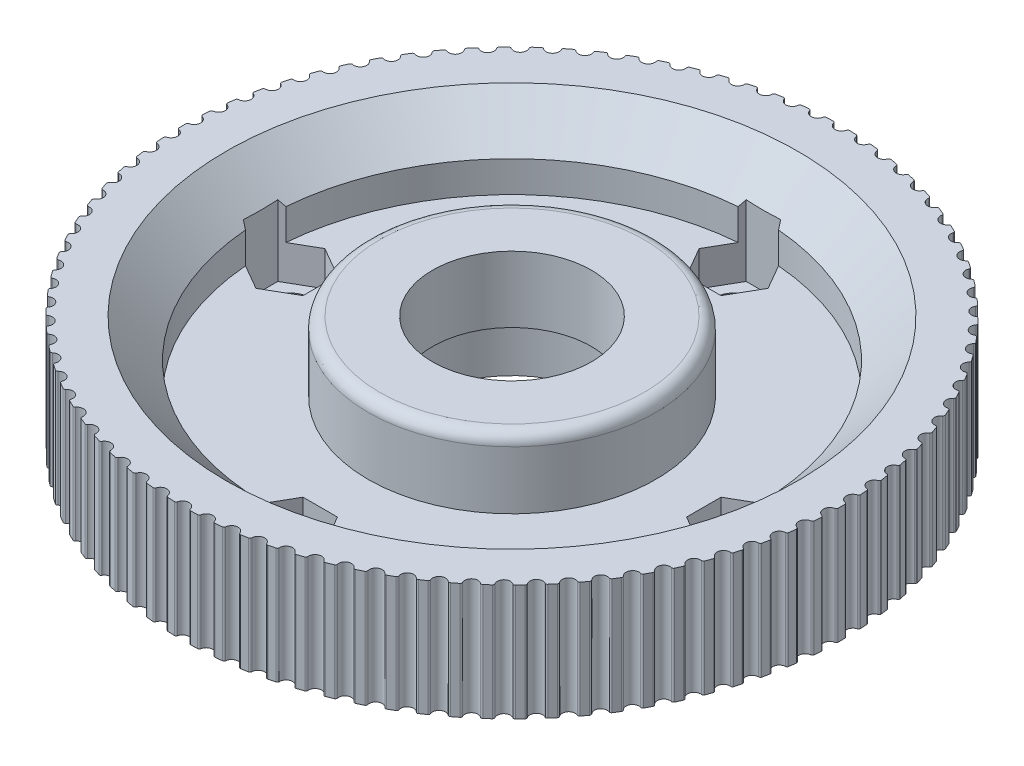
from build123d import *

# Parameters (mm, degrees)
SKETCH1_R           = 6.85
SKETCH1_R_2         = 1.65
BOSS_EXTRUDE1_DEPTH = 10
CIRPATTERN1_START   = -1
CIRPATTERN1_DEPTH   = 12
SKETCH1_3_R         = 7.85
CUT_EXTRUDE1_DEPTH  = 4.3
CUT_EXTRUDE2_DEPTH  = 9
SKETCH2_3_R         = 12.4
CUT_EXTRUDE3_DEPTH  = 6
CHAMFER1_SIZE       = 3.32
FILLET1_R           = 1
CUT_EXTRUDE4_DEPTH  = 9


with BuildPart() as part:
    # Sketch1 → Boss-Extrude1 (new body)
    with BuildSketch(Plane(origin=(0, 0, 0), x_dir=(1, 0, 0), z_dir=(0, 1, 0))):
        with BuildLine():
            ThreePointArc((-0.695761821, 28.391476106), (0, -28.4), (0.695761821, 28.391476106))
            ThreePointArc((0.695761821, 28.391476106), (0.60004905, 28.359965255), (0.545871454, 28.275002579))
            ThreePointArc((0.545871454, 28.275002579), (0, 27.84), (-0.545871454, 28.275002579))
            ThreePointArc((-0.545871454, 28.275002579), (-0.60004905, 28.359965255), (-0.695761821, 28.391476106))
        make_face()
        with Locations(Location((0, 0, 0), (0, 0, 270))):
            Circle(SKETCH1_R, mode=Mode.SUBTRACT)
        with Locations(Location((0, 19.1, 0), (0, 0, 270))):
            Circle(SKETCH1_R_2, mode=Mode.SUBTRACT)
        with Locations(Location((19.1, 0, 0), (0, 0, 270))):
            Circle(SKETCH1_R_2, mode=Mode.SUBTRACT)
        with Locations(Location((0, -19.1, 0), (0, 0, 270))):
            Circle(SKETCH1_R_2, mode=Mode.SUBTRACT)
        with Locations(Location((-19.1, 0, 0), (0, 0, 270))):
            Circle(SKETCH1_R_2, mode=Mode.SUBTRACT)
    extrude(amount=BOSS_EXTRUDE1_DEPTH)

    # CirPattern1: read off the stored shape, not the designer's step
    # CirPattern1 outline → CirPattern1 (cut)
    with BuildSketch(Plane(origin=(0, 0, 0), x_dir=(1, 0, 0), z_dir=(0, 1, 0)).offset(CIRPATTERN1_START)):
        with BuildLine():
            ThreePointArc((-2.516906214, 28.168048026), (-1.942020229, 27.772183159), (-1.427822736, 28.244204161))
            ThreePointArc((-1.427822736, 28.244204161), (-1.379703811, 28.332739111), (-1.286422278, 28.370849789))
            ThreePointArc((-1.286422278, 28.370849789), (-1.981083855, 28.330819027), (-2.674556238, 28.273782006))
            ThreePointArc((-2.674556238, 28.273782006), (-2.576878532, 28.2490245), (-2.516906214, 28.168048026))
        make_face()
        with BuildLine():
            ThreePointArc((2.516906214, 28.168048026), (2.576878532, 28.2490245), (2.674556238, 28.273782006))
            ThreePointArc((2.674556238, 28.273782006), (1.981083855, 28.330819027), (1.286422278, 28.370849788))
            ThreePointArc((1.286422278, 28.370849788), (1.379703811, 28.332739111), (1.427822736, 28.244204161))
            ThreePointArc((1.427822736, 28.244204161), (1.942020229, 27.772183159), (2.516906214, 28.168048026))
        make_face()
        with BuildLine():
            ThreePointArc((4.475678859, 27.923861574), (4.541153721, 28.000457336), (4.640320485, 28.018340882))
            ThreePointArc((4.640320485, 28.018340882), (3.952516067, 28.123613152), (3.262339056, 28.212003542))
            ThreePointArc((3.262339056, 28.212003542), (3.352734894, 28.16747871), (3.394560718, 28.07580282))
            ThreePointArc((3.394560718, 28.07580282), (3.874579131, 27.569063034), (4.475678859, 27.923861574))
        make_face()
        with BuildLine():
            ThreePointArc((6.412646447, 27.543632876), (6.483304866, 27.615474759), (6.583477558, 27.626397218))
            ThreePointArc((6.583477558, 27.626397218), (5.904692019, 27.779391861), (5.222362046, 27.915711251))
            ThreePointArc((5.222362046, 27.915711251), (5.309431789, 27.864989184), (5.344760741, 27.77061899))
            ThreePointArc((5.344760741, 27.77061899), (5.788261472, 27.231629204), (6.412646447, 27.543632876))
        make_face()
        with BuildLine():
            ThreePointArc((8.318372267, 27.029214367), (8.393870001, 27.095952365), (8.49456059, 27.099860523))
            ThreePointArc((8.49456059, 27.099860523), (7.828100905, 27.299832164), (7.156942214, 27.48341642))
            ThreePointArc((7.156942214, 27.48341642), (7.240261667, 27.426744232), (7.268921627, 27.330139496))
            ThreePointArc((7.268921627, 27.330139496), (7.673743986, 26.761525615), (8.318372267, 27.029214367))
        make_face()
        with BuildLine():
            ThreePointArc((10.183571812, 26.383112243), (10.263541046, 26.444421214), (10.364258976, 26.441296033))
            ThreePointArc((10.364258976, 26.441296033), (9.71337207, 26.68727043), (9.056654478, 26.917225148))
            ThreePointArc((9.056654478, 26.917225148), (9.135817717, 26.854878938), (9.157669057, 26.756510309))
            ThreePointArc((9.157669057, 26.756510309), (9.52184079, 26.161042563), (10.183571812, 26.383112243))
        make_face()
        with BuildLine():
            ThreePointArc((11.999158019, 25.608474248), (12.083209149, 25.664055502), (12.183463734, 25.653912205))
            ThreePointArc((12.183463734, 25.653912205), (11.551320663, 25.944690997), (10.912243632, 26.21989586))
            ThreePointArc((10.912243632, 26.21989586), (10.986864982, 26.152179374), (11.001801244, 26.052526094))
            ThreePointArc((11.001801244, 26.052526094), (11.323548143, 25.433105541), (11.999158019, 25.608474248))
        make_face()
        with BuildLine():
            ThreePointArc((13.756285535, 24.70907434), (13.844009073, 24.758657091), (13.943311882, 24.741545096))
            ThreePointArc((13.943311882, 24.741545096), (13.332992383, 25.075711637), (12.714669432, 25.394825875))
            ThreePointArc((12.714669432, 25.394825875), (12.784385345, 25.322069021), (12.792333762, 25.22161659))
            ThreePointArc((12.792333762, 25.22161659), (13.070088308, 24.581260985), (13.756285535, 24.70907434))
        make_face()
        with BuildLine():
            ThreePointArc((15.44639381, 23.689294306), (15.537362376, 23.732636991), (15.635229616, 23.708639667))
            ThreePointArc((15.635229616, 23.708639667), (15.049707104, 24.084565931), (14.455150641, 24.446034851))
            ThreePointArc((14.455150641, 24.446034851), (14.519621467, 24.368592093), (14.520543315, 24.267829905))
            ThreePointArc((14.520543315, 24.267829905), (14.752952316, 23.609658997), (15.44639381, 23.689294306))
        make_face()
        with BuildLine():
            ThreePointArc((17.061248808, 22.554102412), (17.155019212, 22.590993869), (17.250974083, 22.560228128))
            ThreePointArc((17.250974083, 22.560228128), (16.693101165, 22.97608264), (16.125207809, 23.378145203))
            ThreePointArc((16.125207809, 23.378145203), (16.184119454, 23.296393834), (16.178010241, 23.195812793))
            ThreePointArc((16.178010241, 23.195812793), (16.363941424, 22.523033123), (17.061248808, 22.554102412))
        make_face()
        with BuildLine():
            ThreePointArc((18.592983116, 21.309029197), (18.689098517, 21.339289696), (18.782673538, 21.301905425))
            ThreePointArc((18.782673538, 21.301905425), (18.255168115, 21.755662185), (17.716704585, 22.196359581))
            ThreePointArc((17.716704585, 22.196359581), (17.769770037, 22.110697885), (17.756659527, 22.010788012))
            ThreePointArc((17.756659527, 22.010788012), (17.895207054, 21.326677296), (18.592983116, 21.309029197))
        make_face()
        with BuildLine():
            ThreePointArc((20.034134279, 19.960140535), (20.132126414, 19.983622649), (20.222865696, 19.939801981))
            ThreePointArc((20.222865696, 19.939801981), (19.728297721, 20.429250329), (19.221887358, 20.906435526))
            ThreePointArc((19.221887358, 20.906435526), (19.268848087, 20.81728084), (19.248800153, 20.718528885))
            ThreePointArc((19.248800153, 20.718528885), (19.339289033, 20.026420042), (20.034134279, 19.960140535))
        make_face()
        with BuildLine():
            ThreePointArc((21.377681154, 18.514008074), (21.477072615, 18.530597401), (21.564534085, 18.480553825))
            ThreePointArc((21.564534085, 18.480553825), (21.105313044, 19.00330922), (20.633423027, 19.514657419))
            ThreePointArc((20.633423027, 19.514657419), (20.674050246, 19.422444094), (20.64716256, 19.325331167))
            ThreePointArc((20.64716256, 19.325331167), (20.689151941, 18.628596081), (21.377681154, 18.514008074))
        make_face()
        with BuildLine():
            ThreePointArc((22.617078115, 16.977677226), (22.717384676, 16.987292945), (22.801142232, 16.931270269))
            ThreePointArc((22.801142232, 16.931270269), (22.379505402, 17.484785899), (21.944434733, 18.027805863))
            ThreePointArc((21.944434733, 18.027805863), (21.97853051, 17.932983153), (21.944934065, 17.837982379))
            ThreePointArc((21.944934065, 17.837982379), (21.93821938, 17.140015473), (22.617078115, 16.977677226))
        make_face()
        with BuildLine():
            ThreePointArc((23.746286945, 15.358632842), (23.847019923, 15.361228106), (23.926665505, 15.299499267))
            ThreePointArc((23.926665505, 15.299499267), (23.54466706, 15.881078459), (23.148535359, 16.453124649))
            ThreePointArc((23.148535359, 16.453124649), (23.175933583, 16.356154521), (23.135792058, 16.263728733))
            ThreePointArc((23.135792058, 16.263728733), (23.08040602, 15.567930433), (23.746286945, 15.358632842))
        make_face()
        with BuildLine():
            ThreePointArc((24.759806253, 13.664762743), (24.860474887, 13.660324907), (24.935620469, 13.593190641))
            ThreePointArc((24.935620469, 13.593190641), (24.595121467, 14.2), (24.239858648, 14.798285465))
            ThreePointArc((24.239858648, 14.798285465), (24.260425837, 14.699640348), (24.213934798, 14.610239836))
            ThreePointArc((24.213934798, 14.610239836), (24.110147241, 13.92), (24.759806253, 13.664762743))
        make_face()
        with BuildLine():
            ThreePointArc((25.652698272, 11.904319293), (25.752812115, 11.892869978), (25.823091597, 11.820657357))
            ThreePointArc((25.823091597, 11.820657357), (25.525750915, 12.449740569), (25.213087783, 13.071350522))
            ThreePointArc((25.213087783, 13.071350522), (25.226723735, 12.971511005), (25.174109682, 12.885571319))
            ThreePointArc((25.174109682, 12.885571319), (25.022426249, 12.204252727), (25.652698272, 11.904319293))
        make_face()
        with BuildLine():
            ThreePointArc((26.420612925, 10.085879196), (26.519684232, 10.067474183), (26.584755219, 9.990535019))
            ThreePointArc((26.584755219, 9.990535019), (26.33202147, 10.638827253), (26.063481287, 11.280733273))
            ThreePointArc((26.063481287, 11.280733273), (26.07011957, 11.180185765), (26.011638833, 11.098125594))
            ThreePointArc((26.011638833, 11.098125594), (25.812798511, 10.429047561), (26.420612925, 10.085879196))
        make_face()
        with BuildLine():
            ThreePointArc((27.059809007, 8.218301709), (27.157355112, 8.193030665), (27.216900585, 8.111739799))
            ThreePointArc((27.216900585, 8.111739799), (27.010005063, 8.77608264), (26.786896131, 9.435157426))
            ThreePointArc((26.786896131, 9.435157426), (26.786504404, 9.334391783), (26.722441895, 9.256610917))
            ThreePointArc((26.722441895, 9.256610917), (26.477413414, 8.603033124), (27.059809007, 8.218301709))
        make_face()
        with BuildLine():
            ThreePointArc((27.56717242, 6.310685483), (27.662718088, 6.278671525), (27.716447947, 6.193424997))
            ThreePointArc((27.716447947, 6.193424997), (27.556398626, 6.870581835), (27.37980791, 7.54361444))
            ThreePointArc((27.37980791, 7.54361444), (27.372388081, 7.443121582), (27.303055906, 7.369998961))
            ThreePointArc((27.303055906, 7.369998961), (27.01303302, 6.735105573), (27.56717242, 6.310685483))
        make_face()
        with BuildLine():
            ThreePointArc((27.940231339, 4.372324231), (28.033311083, 4.333723329), (28.080963561, 4.244936452))
            ThreePointArc((28.080963561, 4.244936452), (27.968540185, 4.931608246), (27.839328016, 5.615319723))
            ThreePointArc((27.839328016, 5.615319723), (27.824916235, 5.515589242), (27.750652173, 5.447481112))
            ThreePointArc((27.750652173, 5.447481112), (27.417047844, 4.834365267), (27.940231339, 4.372324231))
        make_face()
        with BuildLine():
            ThreePointArc((28.177168261, 2.412661455), (28.267328603, 2.367661668), (28.308671543, 2.275767002))
            ThreePointArc((28.308671543, 2.275767002), (28.244421828, 2.968608356), (28.163217715, 3.659667732))
            ThreePointArc((28.163217715, 3.659667732), (28.141884193, 3.561185505), (28.063050052, 3.498423682))
            ThreePointArc((28.063050052, 3.498423682), (27.687489567, 2.910072417), (28.177168261, 2.412661455))
        make_face()
        with BuildLine():
            ThreePointArc((28.27682885, 0.441244435), (28.363630541, 0.390064998), (28.398462523, 0.295510245))
            ThreePointArc((28.398462523, 0.295510245), (28.382699487, 0.991145706), (28.349899049, 1.686186208))
            ThreePointArc((28.349899049, 1.686186208), (28.321747721, 1.58943203), (28.238727572, 1.532322284))
            ThreePointArc((28.238727572, 1.532322284), (27.823040624, 0.971601988), (28.27682885, 0.441244435))
        make_face()
        with BuildLine():
            ThreePointArc((28.238727572, -1.532322284), (28.321747721, -1.58943203), (28.349899049, -1.686186208))
            ThreePointArc((28.349899049, -1.686186208), (28.382699487, -0.991145706), (28.398462523, -0.295510245))
            ThreePointArc((28.398462523, -0.295510245), (28.363630541, -0.390064998), (28.27682885, -0.441244435))
            ThreePointArc((28.27682885, -0.441244435), (27.823040624, -0.971601988), (28.238727572, -1.532322284))
        make_face()
        with BuildLine():
            ThreePointArc((28.063050052, -3.498423682), (28.141884193, -3.561185505), (28.163217716, -3.659667732))
            ThreePointArc((28.163217716, -3.659667732), (28.244421828, -2.968608356), (28.308671543, -2.275767002))
            ThreePointArc((28.308671543, -2.275767002), (28.267328603, -2.367661668), (28.177168261, -2.412661455))
            ThreePointArc((28.177168261, -2.412661455), (27.687489567, -2.910072417), (28.063050052, -3.498423682))
        make_face()
        with BuildLine():
            ThreePointArc((27.750652173, -5.447481112), (27.824916235, -5.515589242), (27.839328017, -5.615319723))
            ThreePointArc((27.839328017, -5.615319723), (27.968540185, -4.931608246), (28.080963561, -4.244936452))
            ThreePointArc((28.080963561, -4.244936452), (28.033311083, -4.333723329), (27.940231339, -4.372324231))
            ThreePointArc((27.940231339, -4.372324231), (27.417047844, -4.834365267), (27.750652173, -5.447481112))
        make_face()
        with BuildLine():
            ThreePointArc((27.303055906, -7.369998961), (27.372388081, -7.443121582), (27.37980791, -7.54361444))
            ThreePointArc((27.37980791, -7.54361444), (27.556398626, -6.870581835), (27.716447947, -6.193424997))
            ThreePointArc((27.716447947, -6.193424997), (27.662718088, -6.278671525), (27.56717242, -6.310685483))
            ThreePointArc((27.56717242, -6.310685483), (27.01303302, -6.735105573), (27.303055906, -7.369998961))
        make_face()
        with BuildLine():
            ThreePointArc((26.722441895, -9.256610917), (26.786504404, -9.334391783), (26.786896131, -9.435157426))
            ThreePointArc((26.786896131, -9.435157426), (27.010005063, -8.776082641), (27.216900585, -8.111739799))
            ThreePointArc((27.216900585, -8.111739799), (27.157355112, -8.193030665), (27.059809007, -8.218301709))
            ThreePointArc((27.059809007, -8.218301709), (26.477413414, -8.603033124), (26.722441895, -9.256610917))
        make_face()
        with BuildLine():
            ThreePointArc((26.011638833, -11.098125594), (26.07011957, -11.180185765), (26.063481287, -11.280733273))
            ThreePointArc((26.063481287, -11.280733273), (26.33202147, -10.638827253), (26.584755219, -9.990535019))
            ThreePointArc((26.584755219, -9.990535019), (26.519684232, -10.067474183), (26.420612925, -10.085879196))
            ThreePointArc((26.420612925, -10.085879196), (25.812798511, -10.429047561), (26.011638833, -11.098125594))
        make_face()
        with BuildLine():
            ThreePointArc((25.174109682, -12.885571319), (25.226723735, -12.971511005), (25.213087783, -13.071350522))
            ThreePointArc((25.213087783, -13.071350522), (25.525750915, -12.449740569), (25.823091597, -11.820657357))
            ThreePointArc((25.823091597, -11.820657357), (25.752812115, -11.892869978), (25.652698272, -11.904319293))
            ThreePointArc((25.652698272, -11.904319293), (25.022426249, -12.204252727), (25.174109682, -12.885571319))
        make_face()
        with BuildLine():
            ThreePointArc((24.213934798, -14.610239836), (24.260425837, -14.699640348), (24.239858648, -14.798285465))
            ThreePointArc((24.239858648, -14.798285465), (24.595121467, -14.2), (24.935620469, -13.593190641))
            ThreePointArc((24.935620469, -13.593190641), (24.860474887, -13.660324907), (24.759806253, -13.664762743))
            ThreePointArc((24.759806253, -13.664762743), (24.110147241, -13.92), (24.213934798, -14.610239836))
        make_face()
        with BuildLine():
            ThreePointArc((23.135792058, -16.263728733), (23.175933583, -16.356154521), (23.14853536, -16.453124649))
            ThreePointArc((23.14853536, -16.453124649), (23.54466706, -15.881078459), (23.926665505, -15.299499267))
            ThreePointArc((23.926665505, -15.299499267), (23.847019923, -15.361228106), (23.746286945, -15.358632842))
            ThreePointArc((23.746286945, -15.358632842), (23.08040602, -15.567930433), (23.135792058, -16.263728733))
        make_face()
        with BuildLine():
            ThreePointArc((21.944934065, -17.837982379), (21.97853051, -17.932983153), (21.944434733, -18.027805863))
            ThreePointArc((21.944434733, -18.027805863), (22.379505403, -17.484785899), (22.801142232, -16.931270269))
            ThreePointArc((22.801142232, -16.931270269), (22.717384676, -16.987292945), (22.617078115, -16.977677226))
            ThreePointArc((22.617078115, -16.977677226), (21.93821938, -17.140015473), (21.944934065, -17.837982379))
        make_face()
        with BuildLine():
            ThreePointArc((20.64716256, -19.325331167), (20.674050246, -19.422444094), (20.633423027, -19.514657419))
            ThreePointArc((20.633423027, -19.514657419), (21.105313044, -19.00330922), (21.564534085, -18.480553825))
            ThreePointArc((21.564534085, -18.480553825), (21.477072615, -18.530597401), (21.377681154, -18.514008074))
            ThreePointArc((21.377681154, -18.514008074), (20.689151941, -18.628596081), (20.64716256, -19.325331167))
        make_face()
        with BuildLine():
            ThreePointArc((19.248800153, -20.718528885), (19.268848087, -20.81728084), (19.221887358, -20.906435526))
            ThreePointArc((19.221887358, -20.906435526), (19.728297721, -20.42925033), (20.222865696, -19.939801981))
            ThreePointArc((20.222865696, -19.939801981), (20.132126414, -19.983622649), (20.034134279, -19.960140535))
            ThreePointArc((20.034134279, -19.960140535), (19.339289033, -20.026420042), (19.248800153, -20.718528885))
        make_face()
        with BuildLine():
            ThreePointArc((17.756659527, -22.010788012), (17.769770037, -22.110697885), (17.716704585, -22.196359581))
            ThreePointArc((17.716704585, -22.196359581), (18.255168115, -21.755662185), (18.782673538, -21.301905425))
            ThreePointArc((18.782673538, -21.301905425), (18.689098517, -21.339289696), (18.592983116, -21.309029197))
            ThreePointArc((18.592983116, -21.309029197), (17.895207054, -21.326677296), (17.756659527, -22.010788012))
        make_face()
        with BuildLine():
            ThreePointArc((16.178010241, -23.195812793), (16.184119454, -23.296393834), (16.125207809, -23.378145203))
            ThreePointArc((16.125207809, -23.378145203), (16.693101165, -22.97608264), (17.250974083, -22.560228128))
            ThreePointArc((17.250974083, -22.560228128), (17.155019212, -22.590993869), (17.061248808, -22.554102412))
            ThreePointArc((17.061248808, -22.554102412), (16.363941424, -22.523033123), (16.178010241, -23.195812793))
        make_face()
        with BuildLine():
            ThreePointArc((14.520543315, -24.267829905), (14.519621467, -24.368592093), (14.455150641, -24.446034851))
            ThreePointArc((14.455150641, -24.446034851), (15.049707104, -24.084565931), (15.635229616, -23.708639667))
            ThreePointArc((15.635229616, -23.708639667), (15.537362376, -23.732636991), (15.44639381, -23.689294306))
            ThreePointArc((15.44639381, -23.689294306), (14.752952316, -23.609658997), (14.520543315, -24.267829905))
        make_face()
        with BuildLine():
            ThreePointArc((12.792333762, -25.22161659), (12.784385345, -25.322069021), (12.714669432, -25.394825875))
            ThreePointArc((12.714669432, -25.394825875), (13.332992383, -25.075711637), (13.943311882, -24.741545096))
            ThreePointArc((13.943311882, -24.741545096), (13.844009073, -24.758657091), (13.756285535, -24.70907434))
            ThreePointArc((13.756285535, -24.70907434), (13.070088308, -24.581260985), (12.792333762, -25.22161659))
        make_face()
        with BuildLine():
            ThreePointArc((11.001801244, -26.052526094), (10.986864982, -26.152179374), (10.912243632, -26.21989586))
            ThreePointArc((10.912243632, -26.21989586), (11.551320663, -25.944690997), (12.183463734, -25.653912205))
            ThreePointArc((12.183463734, -25.653912205), (12.083209149, -25.664055502), (11.999158019, -25.608474248))
            ThreePointArc((11.999158019, -25.608474248), (11.323548143, -25.433105541), (11.001801244, -26.052526094))
        make_face()
        with BuildLine():
            ThreePointArc((9.157669057, -26.756510309), (9.135817717, -26.854878938), (9.056654478, -26.917225148))
            ThreePointArc((9.056654478, -26.917225148), (9.71337207, -26.68727043), (10.364258976, -26.441296033))
            ThreePointArc((10.364258976, -26.441296033), (10.263541046, -26.444421214), (10.183571812, -26.383112243))
            ThreePointArc((10.183571812, -26.383112243), (9.52184079, -26.161042563), (9.157669057, -26.756510309))
        make_face()
        with BuildLine():
            ThreePointArc((7.268921627, -27.330139496), (7.240261667, -27.426744232), (7.156942214, -27.483416421))
            ThreePointArc((7.156942214, -27.483416421), (7.828100906, -27.299832165), (8.49456059, -27.099860523))
            ThreePointArc((8.49456059, -27.099860523), (8.393870001, -27.095952365), (8.318372267, -27.029214367))
            ThreePointArc((8.318372267, -27.029214367), (7.673743986, -26.761525615), (7.268921627, -27.330139496))
        make_face()
        with BuildLine():
            ThreePointArc((5.344760741, -27.77061899), (5.309431789, -27.864989184), (5.222362046, -27.915711251))
            ThreePointArc((5.222362046, -27.915711251), (5.904692019, -27.779391861), (6.583477558, -27.626397218))
            ThreePointArc((6.583477558, -27.626397218), (6.483304866, -27.615474759), (6.412646447, -27.543632876))
            ThreePointArc((6.412646447, -27.543632876), (5.788261472, -27.231629204), (5.344760741, -27.77061899))
        make_face()
        with BuildLine():
            ThreePointArc((3.394560718, -28.07580282), (3.352734894, -28.16747871), (3.262339056, -28.212003543))
            ThreePointArc((3.262339056, -28.212003543), (3.952516067, -28.123613152), (4.640320485, -28.018340882))
            ThreePointArc((4.640320485, -28.018340882), (4.541153721, -28.000457336), (4.475678859, -27.923861574))
            ThreePointArc((4.475678859, -27.923861574), (3.874579131, -27.569063034), (3.394560718, -28.07580282))
        make_face()
        with BuildLine():
            ThreePointArc((1.427822736, -28.244204161), (1.379703811, -28.332739111), (1.286422278, -28.370849789))
            ThreePointArc((1.286422278, -28.370849789), (1.981083855, -28.330819027), (2.674556238, -28.273782006))
            ThreePointArc((2.674556238, -28.273782006), (2.576878532, -28.2490245), (2.516906214, -28.168048026))
            ThreePointArc((2.516906214, -28.168048026), (1.942020229, -27.772183159), (1.427822736, -28.244204161))
        make_face()
        with BuildLine():
            ThreePointArc((-0.545871454, -28.275002579), (-0.60004905, -28.359965255), (-0.695761821, -28.391476106))
            ThreePointArc((-0.695761821, -28.391476106), (0, -28.4), (0.695761821, -28.391476106))
            ThreePointArc((0.695761821, -28.391476106), (0.60004905, -28.359965255), (0.545871454, -28.275002579))
            ThreePointArc((0.545871454, -28.275002579), (0, -27.84), (-0.545871454, -28.275002579))
        make_face()
        with BuildLine():
            ThreePointArc((-2.516906214, -28.168048026), (-2.576878532, -28.2490245), (-2.674556238, -28.273782006))
            ThreePointArc((-2.674556238, -28.273782006), (-1.981083855, -28.330819027), (-1.286422278, -28.370849789))
            ThreePointArc((-1.286422278, -28.370849789), (-1.379703811, -28.332739111), (-1.427822736, -28.244204161))
            ThreePointArc((-1.427822736, -28.244204161), (-1.942020229, -27.772183159), (-2.516906214, -28.168048026))
        make_face()
        with BuildLine():
            ThreePointArc((-4.475678859, -27.923861574), (-4.541153721, -28.000457336), (-4.640320485, -28.018340882))
            ThreePointArc((-4.640320485, -28.018340882), (-3.952516067, -28.123613152), (-3.262339056, -28.212003543))
            ThreePointArc((-3.262339056, -28.212003543), (-3.352734894, -28.16747871), (-3.394560718, -28.07580282))
            ThreePointArc((-3.394560718, -28.07580282), (-3.874579131, -27.569063034), (-4.475678859, -27.923861574))
        make_face()
        with BuildLine():
            ThreePointArc((-6.412646447, -27.543632876), (-6.483304866, -27.615474759), (-6.583477558, -27.626397218))
            ThreePointArc((-6.583477558, -27.626397218), (-5.904692019, -27.779391861), (-5.222362046, -27.915711251))
            ThreePointArc((-5.222362046, -27.915711251), (-5.309431789, -27.864989184), (-5.344760741, -27.77061899))
            ThreePointArc((-5.344760741, -27.77061899), (-5.788261472, -27.231629204), (-6.412646447, -27.543632876))
        make_face()
        with BuildLine():
            ThreePointArc((-8.318372267, -27.029214367), (-8.393870001, -27.095952365), (-8.49456059, -27.099860523))
            ThreePointArc((-8.49456059, -27.099860523), (-7.828100906, -27.299832165), (-7.156942214, -27.483416421))
            ThreePointArc((-7.156942214, -27.483416421), (-7.240261667, -27.426744232), (-7.268921627, -27.330139496))
            ThreePointArc((-7.268921627, -27.330139496), (-7.673743986, -26.761525615), (-8.318372267, -27.029214367))
        make_face()
        with BuildLine():
            ThreePointArc((-10.183571812, -26.383112243), (-10.263541046, -26.444421214), (-10.364258976, -26.441296033))
            ThreePointArc((-10.364258976, -26.441296033), (-9.71337207, -26.68727043), (-9.056654478, -26.917225148))
            ThreePointArc((-9.056654478, -26.917225148), (-9.135817717, -26.854878938), (-9.157669057, -26.756510309))
            ThreePointArc((-9.157669057, -26.756510309), (-9.52184079, -26.161042563), (-10.183571812, -26.383112243))
        make_face()
        with BuildLine():
            ThreePointArc((-11.999158019, -25.608474248), (-12.083209149, -25.664055502), (-12.183463734, -25.653912205))
            ThreePointArc((-12.183463734, -25.653912205), (-11.551320663, -25.944690997), (-10.912243632, -26.21989586))
            ThreePointArc((-10.912243632, -26.21989586), (-10.986864982, -26.152179374), (-11.001801244, -26.052526094))
            ThreePointArc((-11.001801244, -26.052526094), (-11.323548143, -25.433105541), (-11.999158019, -25.608474248))
        make_face()
        with BuildLine():
            ThreePointArc((-13.756285535, -24.70907434), (-13.844009073, -24.758657091), (-13.943311882, -24.741545096))
            ThreePointArc((-13.943311882, -24.741545096), (-13.332992383, -25.075711637), (-12.714669432, -25.394825875))
            ThreePointArc((-12.714669432, -25.394825875), (-12.784385345, -25.322069021), (-12.792333762, -25.22161659))
            ThreePointArc((-12.792333762, -25.22161659), (-13.070088308, -24.581260985), (-13.756285535, -24.70907434))
        make_face()
        with BuildLine():
            ThreePointArc((-15.44639381, -23.689294306), (-15.537362376, -23.732636991), (-15.635229616, -23.708639667))
            ThreePointArc((-15.635229616, -23.708639667), (-15.049707104, -24.084565931), (-14.455150641, -24.446034851))
            ThreePointArc((-14.455150641, -24.446034851), (-14.519621467, -24.368592093), (-14.520543315, -24.267829905))
            ThreePointArc((-14.520543315, -24.267829905), (-14.752952316, -23.609658997), (-15.44639381, -23.689294306))
        make_face()
        with BuildLine():
            ThreePointArc((-17.061248808, -22.554102412), (-17.155019212, -22.590993869), (-17.250974083, -22.560228128))
            ThreePointArc((-17.250974083, -22.560228128), (-16.693101165, -22.97608264), (-16.125207809, -23.378145203))
            ThreePointArc((-16.125207809, -23.378145203), (-16.184119454, -23.296393834), (-16.178010241, -23.195812793))
            ThreePointArc((-16.178010241, -23.195812793), (-16.363941424, -22.523033123), (-17.061248808, -22.554102412))
        make_face()
        with BuildLine():
            ThreePointArc((-18.592983116, -21.309029197), (-18.689098517, -21.339289696), (-18.782673538, -21.301905425))
            ThreePointArc((-18.782673538, -21.301905425), (-18.255168115, -21.755662185), (-17.716704585, -22.196359581))
            ThreePointArc((-17.716704585, -22.196359581), (-17.769770037, -22.110697885), (-17.756659527, -22.010788012))
            ThreePointArc((-17.756659527, -22.010788012), (-17.895207054, -21.326677296), (-18.592983116, -21.309029197))
        make_face()
        with BuildLine():
            ThreePointArc((-20.034134279, -19.960140535), (-20.132126414, -19.983622649), (-20.222865696, -19.939801981))
            ThreePointArc((-20.222865696, -19.939801981), (-19.728297721, -20.42925033), (-19.221887358, -20.906435526))
            ThreePointArc((-19.221887358, -20.906435526), (-19.268848087, -20.81728084), (-19.248800153, -20.718528885))
            ThreePointArc((-19.248800153, -20.718528885), (-19.339289033, -20.026420042), (-20.034134279, -19.960140535))
        make_face()
        with BuildLine():
            ThreePointArc((-21.377681154, -18.514008074), (-21.477072615, -18.530597401), (-21.564534085, -18.480553825))
            ThreePointArc((-21.564534085, -18.480553825), (-21.105313044, -19.00330922), (-20.633423027, -19.514657419))
            ThreePointArc((-20.633423027, -19.514657419), (-20.674050246, -19.422444094), (-20.64716256, -19.325331167))
            ThreePointArc((-20.64716256, -19.325331167), (-20.689151941, -18.628596081), (-21.377681154, -18.514008074))
        make_face()
        with BuildLine():
            ThreePointArc((-22.617078115, -16.977677226), (-22.717384676, -16.987292945), (-22.801142232, -16.931270269))
            ThreePointArc((-22.801142232, -16.931270269), (-22.379505403, -17.484785899), (-21.944434733, -18.027805863))
            ThreePointArc((-21.944434733, -18.027805863), (-21.97853051, -17.932983153), (-21.944934065, -17.837982379))
            ThreePointArc((-21.944934065, -17.837982379), (-21.93821938, -17.140015473), (-22.617078115, -16.977677226))
        make_face()
        with BuildLine():
            ThreePointArc((-23.746286945, -15.358632842), (-23.847019923, -15.361228106), (-23.926665505, -15.299499267))
            ThreePointArc((-23.926665505, -15.299499267), (-23.54466706, -15.881078459), (-23.14853536, -16.453124649))
            ThreePointArc((-23.14853536, -16.453124649), (-23.175933583, -16.356154521), (-23.135792058, -16.263728733))
            ThreePointArc((-23.135792058, -16.263728733), (-23.08040602, -15.567930433), (-23.746286945, -15.358632842))
        make_face()
        with BuildLine():
            ThreePointArc((-24.759806253, -13.664762743), (-24.860474887, -13.660324907), (-24.935620469, -13.593190641))
            ThreePointArc((-24.935620469, -13.593190641), (-24.595121467, -14.2), (-24.239858648, -14.798285465))
            ThreePointArc((-24.239858648, -14.798285465), (-24.260425837, -14.699640348), (-24.213934798, -14.610239836))
            ThreePointArc((-24.213934798, -14.610239836), (-24.110147241, -13.92), (-24.759806253, -13.664762743))
        make_face()
        with BuildLine():
            ThreePointArc((-25.652698272, -11.904319293), (-25.752812115, -11.892869978), (-25.823091597, -11.820657357))
            ThreePointArc((-25.823091597, -11.820657357), (-25.525750915, -12.449740569), (-25.213087783, -13.071350522))
            ThreePointArc((-25.213087783, -13.071350522), (-25.226723735, -12.971511005), (-25.174109682, -12.885571319))
            ThreePointArc((-25.174109682, -12.885571319), (-25.022426249, -12.204252727), (-25.652698272, -11.904319293))
        make_face()
        with BuildLine():
            ThreePointArc((-26.420612925, -10.085879196), (-26.519684232, -10.067474183), (-26.584755219, -9.990535019))
            ThreePointArc((-26.584755219, -9.990535019), (-26.33202147, -10.638827253), (-26.063481287, -11.280733273))
            ThreePointArc((-26.063481287, -11.280733273), (-26.07011957, -11.180185765), (-26.011638833, -11.098125594))
            ThreePointArc((-26.011638833, -11.098125594), (-25.812798511, -10.429047561), (-26.420612925, -10.085879196))
        make_face()
        with BuildLine():
            ThreePointArc((-27.059809007, -8.218301709), (-27.157355112, -8.193030665), (-27.216900585, -8.111739799))
            ThreePointArc((-27.216900585, -8.111739799), (-27.010005063, -8.776082641), (-26.786896131, -9.435157426))
            ThreePointArc((-26.786896131, -9.435157426), (-26.786504404, -9.334391783), (-26.722441895, -9.256610917))
            ThreePointArc((-26.722441895, -9.256610917), (-26.477413414, -8.603033124), (-27.059809007, -8.218301709))
        make_face()
        with BuildLine():
            ThreePointArc((-27.56717242, -6.310685483), (-27.662718088, -6.278671525), (-27.716447947, -6.193424997))
            ThreePointArc((-27.716447947, -6.193424997), (-27.556398626, -6.870581835), (-27.37980791, -7.54361444))
            ThreePointArc((-27.37980791, -7.54361444), (-27.372388081, -7.443121582), (-27.303055906, -7.369998961))
            ThreePointArc((-27.303055906, -7.369998961), (-27.01303302, -6.735105573), (-27.56717242, -6.310685483))
        make_face()
        with BuildLine():
            ThreePointArc((-27.940231339, -4.372324231), (-28.033311083, -4.333723329), (-28.080963561, -4.244936452))
            ThreePointArc((-28.080963561, -4.244936452), (-27.968540185, -4.931608246), (-27.839328016, -5.615319723))
            ThreePointArc((-27.839328016, -5.615319723), (-27.824916235, -5.515589242), (-27.750652173, -5.447481112))
            ThreePointArc((-27.750652173, -5.447481112), (-27.417047844, -4.834365267), (-27.940231339, -4.372324231))
        make_face()
        with BuildLine():
            ThreePointArc((-28.177168261, -2.412661455), (-28.267328603, -2.367661668), (-28.308671543, -2.275767002))
            ThreePointArc((-28.308671543, -2.275767002), (-28.244421828, -2.968608356), (-28.163217715, -3.659667732))
            ThreePointArc((-28.163217715, -3.659667732), (-28.141884193, -3.561185505), (-28.063050052, -3.498423682))
            ThreePointArc((-28.063050052, -3.498423682), (-27.687489567, -2.910072417), (-28.177168261, -2.412661455))
        make_face()
        with BuildLine():
            ThreePointArc((-28.27682885, -0.441244435), (-28.363630541, -0.390064998), (-28.398462523, -0.295510245))
            ThreePointArc((-28.398462523, -0.295510245), (-28.382699487, -0.991145706), (-28.349899049, -1.686186208))
            ThreePointArc((-28.349899049, -1.686186208), (-28.321747721, -1.58943203), (-28.238727572, -1.532322284))
            ThreePointArc((-28.238727572, -1.532322284), (-27.823040624, -0.971601988), (-28.27682885, -0.441244435))
        make_face()
        with BuildLine():
            ThreePointArc((-28.238727572, 1.532322284), (-28.321747721, 1.58943203), (-28.349899049, 1.686186208))
            ThreePointArc((-28.349899049, 1.686186208), (-28.382699487, 0.991145706), (-28.398462523, 0.295510245))
            ThreePointArc((-28.398462523, 0.295510245), (-28.363630541, 0.390064998), (-28.27682885, 0.441244435))
            ThreePointArc((-28.27682885, 0.441244435), (-27.823040624, 0.971601988), (-28.238727572, 1.532322284))
        make_face()
        with BuildLine():
            ThreePointArc((-28.063050052, 3.498423682), (-28.141884193, 3.561185505), (-28.163217716, 3.659667732))
            ThreePointArc((-28.163217716, 3.659667732), (-28.244421828, 2.968608356), (-28.308671543, 2.275767002))
            ThreePointArc((-28.308671543, 2.275767002), (-28.267328603, 2.367661668), (-28.177168261, 2.412661455))
            ThreePointArc((-28.177168261, 2.412661455), (-27.687489567, 2.910072417), (-28.063050052, 3.498423682))
        make_face()
        with BuildLine():
            ThreePointArc((-27.750652173, 5.447481112), (-27.824916235, 5.515589242), (-27.839328017, 5.615319723))
            ThreePointArc((-27.839328017, 5.615319723), (-27.968540185, 4.931608246), (-28.080963561, 4.244936452))
            ThreePointArc((-28.080963561, 4.244936452), (-28.033311083, 4.333723329), (-27.940231339, 4.372324231))
            ThreePointArc((-27.940231339, 4.372324231), (-27.417047844, 4.834365267), (-27.750652173, 5.447481112))
        make_face()
        with BuildLine():
            ThreePointArc((-27.303055906, 7.369998961), (-27.372388081, 7.443121582), (-27.37980791, 7.54361444))
            ThreePointArc((-27.37980791, 7.54361444), (-27.556398626, 6.870581835), (-27.716447947, 6.193424997))
            ThreePointArc((-27.716447947, 6.193424997), (-27.662718088, 6.278671525), (-27.56717242, 6.310685483))
            ThreePointArc((-27.56717242, 6.310685483), (-27.01303302, 6.735105573), (-27.303055906, 7.369998961))
        make_face()
        with BuildLine():
            ThreePointArc((-26.722441895, 9.256610917), (-26.786504404, 9.334391783), (-26.786896131, 9.435157426))
            ThreePointArc((-26.786896131, 9.435157426), (-27.010005063, 8.77608264), (-27.216900585, 8.111739799))
            ThreePointArc((-27.216900585, 8.111739799), (-27.157355112, 8.193030665), (-27.059809007, 8.218301709))
            ThreePointArc((-27.059809007, 8.218301709), (-26.477413414, 8.603033124), (-26.722441895, 9.256610917))
        make_face()
        with BuildLine():
            ThreePointArc((-26.011638833, 11.098125594), (-26.07011957, 11.180185765), (-26.063481287, 11.280733273))
            ThreePointArc((-26.063481287, 11.280733273), (-26.33202147, 10.638827253), (-26.584755219, 9.990535019))
            ThreePointArc((-26.584755219, 9.990535019), (-26.519684232, 10.067474183), (-26.420612925, 10.085879196))
            ThreePointArc((-26.420612925, 10.085879196), (-25.812798511, 10.429047561), (-26.011638833, 11.098125594))
        make_face()
        with BuildLine():
            ThreePointArc((-25.174109682, 12.885571319), (-25.226723735, 12.971511005), (-25.213087783, 13.071350522))
            ThreePointArc((-25.213087783, 13.071350522), (-25.525750915, 12.449740569), (-25.823091597, 11.820657357))
            ThreePointArc((-25.823091597, 11.820657357), (-25.752812115, 11.892869978), (-25.652698272, 11.904319293))
            ThreePointArc((-25.652698272, 11.904319293), (-25.022426249, 12.204252727), (-25.174109682, 12.885571319))
        make_face()
        with BuildLine():
            ThreePointArc((-24.213934798, 14.610239836), (-24.260425837, 14.699640348), (-24.239858648, 14.798285465))
            ThreePointArc((-24.239858648, 14.798285465), (-24.595121467, 14.2), (-24.935620469, 13.593190641))
            ThreePointArc((-24.935620469, 13.593190641), (-24.860474887, 13.660324907), (-24.759806253, 13.664762743))
            ThreePointArc((-24.759806253, 13.664762743), (-24.110147241, 13.92), (-24.213934798, 14.610239836))
        make_face()
        with BuildLine():
            ThreePointArc((-23.135792058, 16.263728733), (-23.175933583, 16.356154521), (-23.14853536, 16.453124649))
            ThreePointArc((-23.14853536, 16.453124649), (-23.54466706, 15.881078459), (-23.926665505, 15.299499267))
            ThreePointArc((-23.926665505, 15.299499267), (-23.847019923, 15.361228106), (-23.746286945, 15.358632842))
            ThreePointArc((-23.746286945, 15.358632842), (-23.08040602, 15.567930433), (-23.135792058, 16.263728733))
        make_face()
        with BuildLine():
            ThreePointArc((-21.944934065, 17.837982379), (-21.97853051, 17.932983153), (-21.944434733, 18.027805863))
            ThreePointArc((-21.944434733, 18.027805863), (-22.379505402, 17.484785899), (-22.801142232, 16.931270269))
            ThreePointArc((-22.801142232, 16.931270269), (-22.717384676, 16.987292945), (-22.617078115, 16.977677226))
            ThreePointArc((-22.617078115, 16.977677226), (-21.93821938, 17.140015473), (-21.944934065, 17.837982379))
        make_face()
        with BuildLine():
            ThreePointArc((-20.64716256, 19.325331167), (-20.674050246, 19.422444094), (-20.633423027, 19.514657419))
            ThreePointArc((-20.633423027, 19.514657419), (-21.105313044, 19.00330922), (-21.564534085, 18.480553825))
            ThreePointArc((-21.564534085, 18.480553825), (-21.477072615, 18.530597401), (-21.377681154, 18.514008074))
            ThreePointArc((-21.377681154, 18.514008074), (-20.689151941, 18.628596081), (-20.64716256, 19.325331167))
        make_face()
        with BuildLine():
            ThreePointArc((-19.248800153, 20.718528885), (-19.268848087, 20.81728084), (-19.221887358, 20.906435526))
            ThreePointArc((-19.221887358, 20.906435526), (-19.728297721, 20.429250329), (-20.222865696, 19.939801981))
            ThreePointArc((-20.222865696, 19.939801981), (-20.132126414, 19.983622649), (-20.034134279, 19.960140535))
            ThreePointArc((-20.034134279, 19.960140535), (-19.339289033, 20.026420042), (-19.248800153, 20.718528885))
        make_face()
        with BuildLine():
            ThreePointArc((-17.756659527, 22.010788012), (-17.769770037, 22.110697885), (-17.716704585, 22.196359581))
            ThreePointArc((-17.716704585, 22.196359581), (-18.255168115, 21.755662185), (-18.782673538, 21.301905425))
            ThreePointArc((-18.782673538, 21.301905425), (-18.689098517, 21.339289696), (-18.592983116, 21.309029197))
            ThreePointArc((-18.592983116, 21.309029197), (-17.895207054, 21.326677296), (-17.756659527, 22.010788012))
        make_face()
        with BuildLine():
            ThreePointArc((-16.178010241, 23.195812793), (-16.184119454, 23.296393834), (-16.125207809, 23.378145203))
            ThreePointArc((-16.125207809, 23.378145203), (-16.693101165, 22.97608264), (-17.250974083, 22.560228128))
            ThreePointArc((-17.250974083, 22.560228128), (-17.155019212, 22.590993869), (-17.061248808, 22.554102412))
            ThreePointArc((-17.061248808, 22.554102412), (-16.363941424, 22.523033123), (-16.178010241, 23.195812793))
        make_face()
        with BuildLine():
            ThreePointArc((-14.520543315, 24.267829905), (-14.519621467, 24.368592093), (-14.455150641, 24.446034851))
            ThreePointArc((-14.455150641, 24.446034851), (-15.049707104, 24.084565931), (-15.635229616, 23.708639667))
            ThreePointArc((-15.635229616, 23.708639667), (-15.537362376, 23.732636991), (-15.44639381, 23.689294306))
            ThreePointArc((-15.44639381, 23.689294306), (-14.752952316, 23.609658997), (-14.520543315, 24.267829905))
        make_face()
        with BuildLine():
            ThreePointArc((-12.792333762, 25.22161659), (-12.784385345, 25.322069021), (-12.714669432, 25.394825875))
            ThreePointArc((-12.714669432, 25.394825875), (-13.332992383, 25.075711637), (-13.943311882, 24.741545096))
            ThreePointArc((-13.943311882, 24.741545096), (-13.844009073, 24.758657091), (-13.756285535, 24.70907434))
            ThreePointArc((-13.756285535, 24.70907434), (-13.070088308, 24.581260985), (-12.792333762, 25.22161659))
        make_face()
        with BuildLine():
            ThreePointArc((-11.001801244, 26.052526094), (-10.986864982, 26.152179374), (-10.912243632, 26.21989586))
            ThreePointArc((-10.912243632, 26.21989586), (-11.551320663, 25.944690997), (-12.183463734, 25.653912205))
            ThreePointArc((-12.183463734, 25.653912205), (-12.083209149, 25.664055502), (-11.999158019, 25.608474248))
            ThreePointArc((-11.999158019, 25.608474248), (-11.323548143, 25.433105541), (-11.001801244, 26.052526094))
        make_face()
        with BuildLine():
            ThreePointArc((-9.157669057, 26.756510309), (-9.135817717, 26.854878938), (-9.056654478, 26.917225148))
            ThreePointArc((-9.056654478, 26.917225148), (-9.71337207, 26.68727043), (-10.364258976, 26.441296032))
            ThreePointArc((-10.364258976, 26.441296032), (-10.263541046, 26.444421214), (-10.183571812, 26.383112243))
            ThreePointArc((-10.183571812, 26.383112243), (-9.52184079, 26.161042563), (-9.157669057, 26.756510309))
        make_face()
        with BuildLine():
            ThreePointArc((-7.268921627, 27.330139496), (-7.240261667, 27.426744232), (-7.156942214, 27.483416421))
            ThreePointArc((-7.156942214, 27.483416421), (-7.828100905, 27.299832164), (-8.49456059, 27.099860523))
            ThreePointArc((-8.49456059, 27.099860523), (-8.393870001, 27.095952365), (-8.318372267, 27.029214367))
            ThreePointArc((-8.318372267, 27.029214367), (-7.673743986, 26.761525615), (-7.268921627, 27.330139496))
        make_face()
        with BuildLine():
            ThreePointArc((-5.344760741, 27.77061899), (-5.309431789, 27.864989184), (-5.222362046, 27.915711251))
            ThreePointArc((-5.222362046, 27.915711251), (-5.904692019, 27.779391861), (-6.583477558, 27.626397218))
            ThreePointArc((-6.583477558, 27.626397218), (-6.483304866, 27.615474759), (-6.412646447, 27.543632876))
            ThreePointArc((-6.412646447, 27.543632876), (-5.788261472, 27.231629204), (-5.344760741, 27.77061899))
        make_face()
        with BuildLine():
            ThreePointArc((-3.394560718, 28.07580282), (-3.352734894, 28.16747871), (-3.262339056, 28.212003543))
            ThreePointArc((-3.262339056, 28.212003543), (-3.952516067, 28.123613152), (-4.640320485, 28.018340882))
            ThreePointArc((-4.640320485, 28.018340882), (-4.541153721, 28.000457336), (-4.475678859, 27.923861574))
            ThreePointArc((-4.475678859, 27.923861574), (-3.874579131, 27.569063034), (-3.394560718, 28.07580282))
        make_face()
    extrude(amount=CIRPATTERN1_DEPTH, mode=Mode.SUBTRACT)

    # Sketch1<3> → Cut-Extrude1 (cut)
    with BuildSketch(Plane(origin=(0, 0, 0), x_dir=(1, 0, 0), z_dir=(0, 1, 0))):
        with Locations(Location((0, 0, 0), (0, 0, 90))):
            Circle(SKETCH1_3_R)
    extrude(amount=CUT_EXTRUDE1_DEPTH, mode=Mode.SUBTRACT)

    # Sketch2 → Cut-Extrude2 (cut)
    with BuildSketch(Plane(origin=(0, 10, 0), x_dir=(1, 0, 0), z_dir=(0, 1, 0))):
        with BuildLine():
            ThreePointArc((-1.74097686, -21.228730522), (0, -21.3), (1.74097686, -21.228730522))
            Line((1.74097686, -21.228730522), (2.97, -19.1))
            Line((2.97, -19.1), (1.485, -16.527904551))
            Line((1.485, -16.527904551), (-1.485, -16.527904551))
            Line((-1.485, -16.527904551), (-2.97, -19.1))
            Line((-2.97, -19.1), (-1.74097686, -21.228730522))
        make_face()
        with BuildLine():
            Line((-19.1, 2.97), (-21.228730522, 1.74097686))
            ThreePointArc((-21.228730522, 1.74097686), (-21.3, 0), (-21.228730522, -1.74097686))
            Line((-21.228730522, -1.74097686), (-19.1, -2.97))
            Line((-19.1, -2.97), (-16.527904551, -1.485))
            Line((-16.527904551, -1.485), (-16.527904551, 1.485))
            Line((-16.527904551, 1.485), (-19.1, 2.97))
        make_face()
        with BuildLine():
            Line((21.228730522, 1.74097686), (19.1, 2.97))
            Line((19.1, 2.97), (16.527904551, 1.485))
            Line((16.527904551, 1.485), (16.527904551, -1.485))
            Line((16.527904551, -1.485), (19.1, -2.97))
            Line((19.1, -2.97), (21.228730522, -1.74097686))
            ThreePointArc((21.228730522, -1.74097686), (21.282175172, -0.871217505), (21.3, 0))
            ThreePointArc((21.3, 0), (21.282175172, 0.871217505), (21.228730522, 1.74097686))
        make_face()
        with BuildLine():
            Line((2.97, 19.1), (1.74097686, 21.228730522))
            ThreePointArc((1.74097686, 21.228730522), (0, 21.3), (-1.74097686, 21.228730522))
            Line((-1.74097686, 21.228730522), (-2.97, 19.1))
            Line((-2.97, 19.1), (-1.485, 16.527904551))
            Line((-1.485, 16.527904551), (1.485, 16.527904551))
            Line((1.485, 16.527904551), (2.97, 19.1))
        make_face()
    extrude(amount=-CUT_EXTRUDE2_DEPTH, mode=Mode.SUBTRACT)

    # Sketch2<3> → Cut-Extrude3 (cut)
    with BuildSketch(Plane(origin=(0, 10, 0), x_dir=(1, 0, 0), z_dir=(0, 1, 0))):
        with BuildLine():
            Line((16.527904551, 1.485), (19.1, 2.97))
            Line((19.1, 2.97), (21.228730522, 1.74097686))
            ThreePointArc((21.228730522, 1.74097686), (15.061374439, 15.061374439), (1.74097686, 21.228730522))
            Line((1.74097686, 21.228730522), (2.97, 19.1))
            Line((2.97, 19.1), (1.485, 16.527904551))
            Line((1.485, 16.527904551), (-1.485, 16.527904551))
            Line((-1.485, 16.527904551), (-2.97, 19.1))
            Line((-2.97, 19.1), (-1.74097686, 21.228730522))
            ThreePointArc((-1.74097686, 21.228730522), (-15.061374439, 15.061374439), (-21.228730522, 1.74097686))
            Line((-21.228730522, 1.74097686), (-19.1, 2.97))
            Line((-19.1, 2.97), (-16.527904551, 1.485))
            Line((-16.527904551, 1.485), (-16.527904551, -1.485))
            Line((-16.527904551, -1.485), (-19.1, -2.97))
            Line((-19.1, -2.97), (-21.228730522, -1.74097686))
            ThreePointArc((-21.228730522, -1.74097686), (-15.061374439, -15.061374439), (-1.74097686, -21.228730522))
            Line((-1.74097686, -21.228730522), (-2.97, -19.1))
            Line((-2.97, -19.1), (-1.485, -16.527904551))
            Line((-1.485, -16.527904551), (1.485, -16.527904551))
            Line((1.485, -16.527904551), (2.97, -19.1))
            Line((2.97, -19.1), (1.74097686, -21.228730522))
            ThreePointArc((1.74097686, -21.228730522), (15.061374439, -15.061374439), (21.228730522, -1.74097686))
            Line((21.228730522, -1.74097686), (19.1, -2.97))
            Line((19.1, -2.97), (16.527904551, -1.485))
            Line((16.527904551, -1.485), (16.527904551, 1.485))
        make_face()
        with Locations(Location((0, 0, 0), (0, 0, 270))):
            Circle(SKETCH2_3_R, mode=Mode.SUBTRACT)
    extrude(amount=-CUT_EXTRUDE3_DEPTH, mode=Mode.SUBTRACT)

    # Chamfer1
    chamfer1_edges = [part.edges().sort_by_distance(p)[0] for p in [
        (-21.228730522, 10, 1.74097686),
    ]]
    chamfer(chamfer1_edges, length=CHAMFER1_SIZE)

    # Fillet1
    fillet1_edges = [part.edges().sort_by_distance(p)[0] for p in [
        (0, 10, -12.4),
    ]]
    fillet(fillet1_edges, radius=FILLET1_R)

    # Sketch2<4> → Cut-Extrude4 (cut)
    with BuildSketch(Plane(origin=(0, 10, 0), x_dir=(1, 0, 0), z_dir=(0, 1, 0))):
        Polygon((19.1, 2.97), (16.527904551, 1.485), (16.527904551, -1.485), (19.1, -2.97), (21.672095449, -1.485), (21.672095449, 1.485), align=None)
        Polygon((-2.97, 19.1), (-1.485, 16.527904551), (1.485, 16.527904551), (2.97, 19.1), (1.485, 21.672095449), (-1.485, 21.672095449), align=None)
        Polygon((2.97, -19.1), (1.485, -16.527904551), (-1.485, -16.527904551), (-2.97, -19.1), (-1.485, -21.672095449), (1.485, -21.672095449), align=None)
        Polygon((-19.1, -2.97), (-16.527904551, -1.485), (-16.527904551, 1.485), (-19.1, 2.97), (-21.672095449, 1.485), (-21.672095449, -1.485), align=None)
    extrude(amount=-CUT_EXTRUDE4_DEPTH, mode=Mode.SUBTRACT)


solid = part.part
